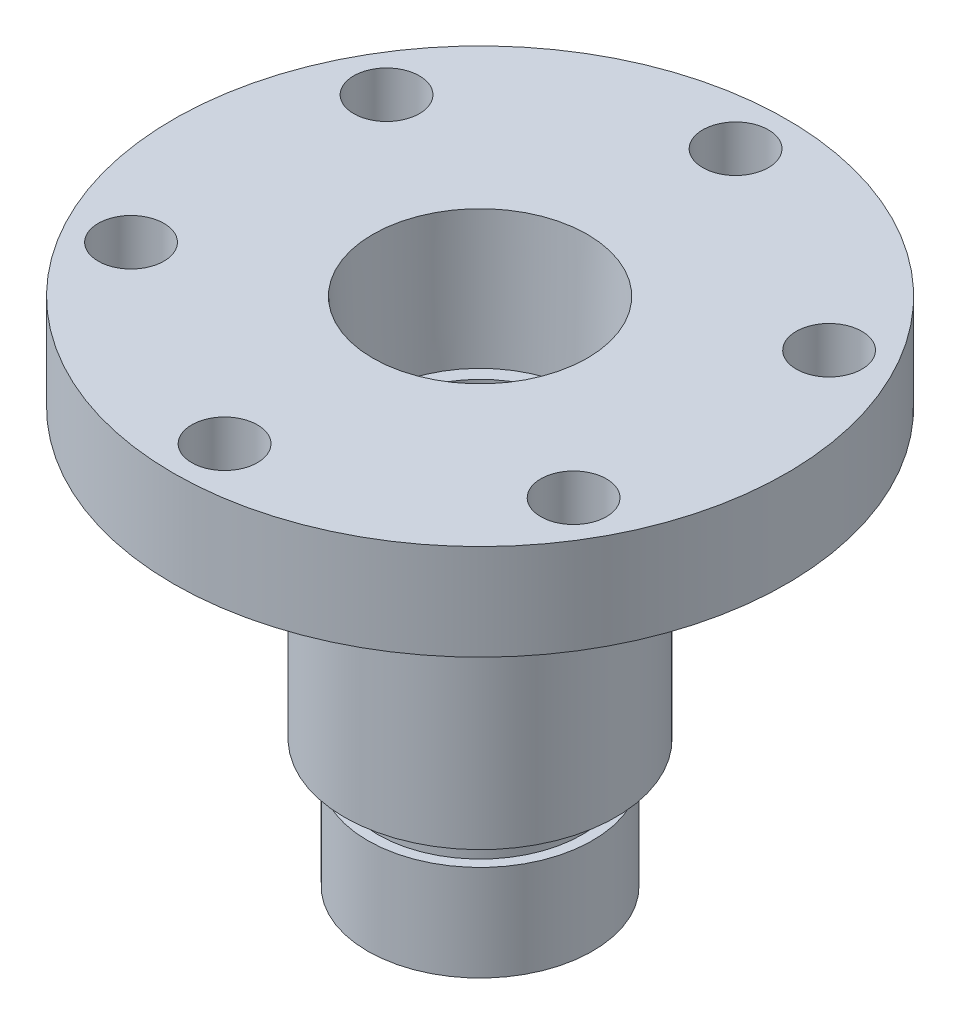
from build123d import *

# Parameters (mm, degrees)
F_1_4_CLEARANCE_HOLE1_D     = 6.5278
F_1_4_CLEARANCE_HOLE1_DEPTH = 22.606
F_1_4_CLEARANCE_HOLE1_TIP   = 1.961148974
CHAMFER1_SIZE               = 1


with BuildPart() as part:
    # Sketch1 → Revolve1 (revolve)
    with BuildSketch(Plane.XY):
        Polygon((-7.5, 0), (-30.48, 0), (-30.48, -9.525), (-21, -9.525), (-21, -7.775), (-18, -7.775), (-18, -9.525), (-13.5, -9.525), (-13.5, -38.101219586), (-11, -38.101219586), (-11, -39.688719586), (-10.16, -39.688719586), (-10.16, -41.276219586), (-11.176, -41.276219586), (-11.176, -50.8), (-7.5, -50.8), align=None)
    revolve(axis=Axis((0, 0, 0), (0, -1, 0)))

    # Sketch3 → 1/2 NPT Tapped Hole1 (revolve, cut)
    with BuildSketch(Plane(origin=(0, 0, 0), x_dir=(0, 0, 1), z_dir=(1, 0, 0))):
        Polygon((0, 0), (0, 27.970543693), (8.9281, 22.606), (8.9281, 13.462), (10.261665792, 13.462), (10.6647361, 0), align=None)
    revolve(axis=Axis((0, 6.35, 0), (0, -1, 0)), mode=Mode.SUBTRACT)

    # 1/4 Clearance Hole1
    with Locations(Plane(origin=(0, 0, 0), x_dir=(1, 0, 0), z_dir=(0, 1, 0))):
        with Locations((21.997045256, 12.7), (0, 25.4), (-21.997045256, 12.7), (-21.997045256, -12.7), (0, -25.4), (21.997045256, -12.7)):
            Hole(F_1_4_CLEARANCE_HOLE1_D / 2, depth=F_1_4_CLEARANCE_HOLE1_DEPTH)
            with Locations((0, 0, -(F_1_4_CLEARANCE_HOLE1_DEPTH + F_1_4_CLEARANCE_HOLE1_TIP / 2))):  # 118° drill point
                Cone(0, F_1_4_CLEARANCE_HOLE1_D / 2, F_1_4_CLEARANCE_HOLE1_TIP, mode=Mode.SUBTRACT)

    # Chamfer1
    chamfer1_edges = [part.edges().sort_by_distance(p)[0] for p in [
        (13.5, -9.525, 0),
    ]]
    chamfer(chamfer1_edges, length=CHAMFER1_SIZE)


solid = part.part
